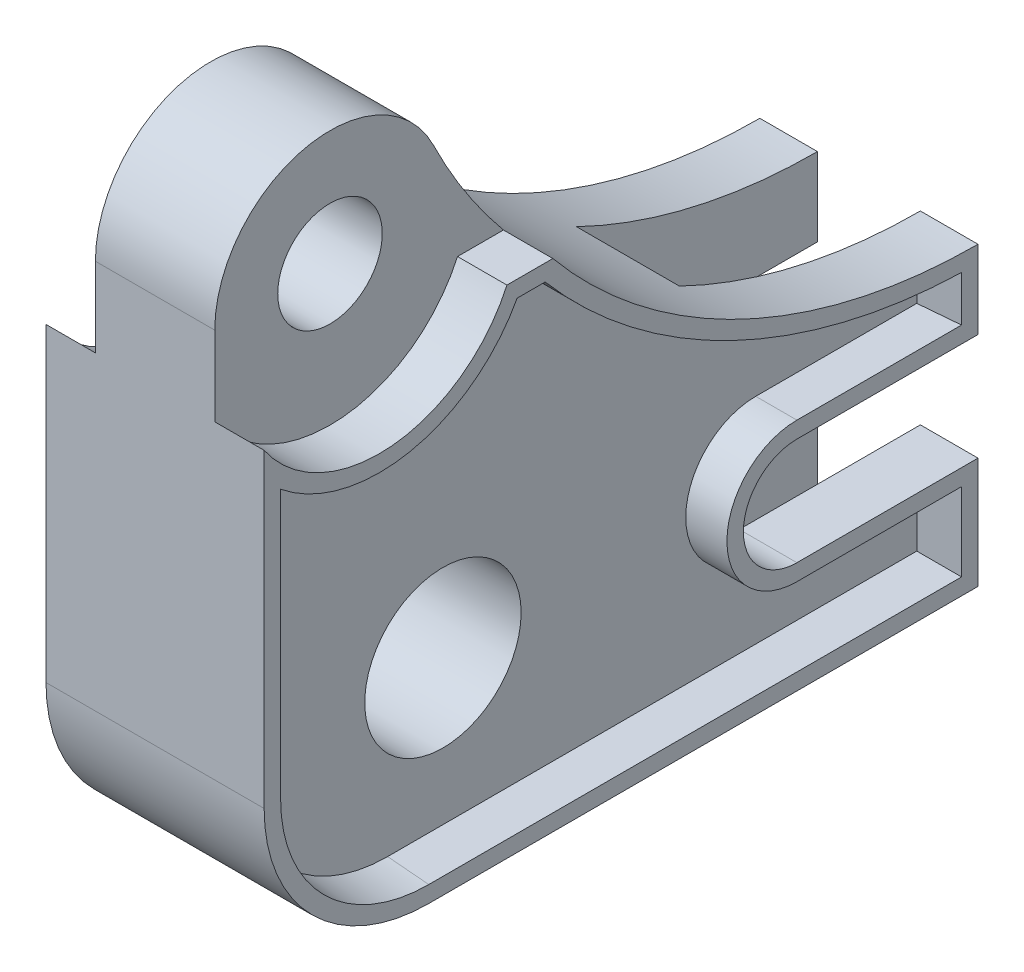
from build123d import *
from OCP.BRepFilletAPI import BRepFilletAPI_MakeChamfer

# Parameters (mm, degrees)
SKETCH2_R           = 6.35
BOSS_EXTRUDE1_DEPTH = 7.25
BOSS_EXTRUDE2_DEPTH = 13.25
SKETCH2_4_R         = 9.5
BOSS_EXTRUDE3_DEPTH = 8.25
CHAMFER1_SIZE       = 0.437443318
CHAMFER1_SIZE_2     = 5
SKETCH3_W           = 12.5
SKETCH3_H           = 38
CUT_EXTRUDE1_DEPTH  = 50


with BuildPart() as part:
    # Sketch2 → Boss-Extrude1 (new, symmetric)
    with BuildSketch(Plane(origin=(0, 0, 0), x_dir=(0, 0, -1), z_dir=(1, 0, 0))):
        with BuildLine():
            ThreePointArc((-17.444074423, 30.751237722), (-33.17807799, 38.221892264), (-44.012704688, 24.584428722))
            Line((-44.012704688, 24.584428722), (-44.012704688, 14.940777961))
            ThreePointArc((-44.012704688, 14.940777961), (-43.308060102, 13.990396231), (-42.539020478, 13.091325888))
            ThreePointArc((-42.539020478, 13.091325888), (-27.32091807, 7.798890756), (-14.520771303, 17.584428722))
            Line((-14.520771303, 17.584428722), (-8.941749337, 17.584428722))
            ThreePointArc((-8.941749337, 17.584428722), (-13.579253126, 23.918357524), (-17.444074423, 30.751237722))
        make_face()
        with Locations(Location((-30.012704688, 24.584428722, 0), (0, 0, 180))):
            Circle(SKETCH2_R, mode=Mode.SUBTRACT)
    extrude(amount=BOSS_EXTRUDE1_DEPTH, both=True)

    # Sketch2<3> → Boss-Extrude2 (add, symmetric)
    with BuildSketch(Plane(origin=(0, 0, 0), x_dir=(0, 0, -1), z_dir=(1, 0, 0))):
        with BuildLine():
            ThreePointArc((-42.539020478, 13.091325888), (-43.308060102, 13.990396231), (-44.012704688, 14.940777961))
            Line((-44.012704688, 14.940777961), (-44.012704688, -22.736176348))
            ThreePointArc((-44.012704688, -22.736176348), (-38.154840312, -36.878311972), (-24.012704688, -42.736176348))
            Line((-24.012704688, -42.736176348), (42.705798991, -42.736176348))
            Line((42.705798991, -42.736176348), (42.705798991, -29.236176348))
            Line((42.705798991, -29.236176348), (20.705798991, -29.236176348))
            ThreePointArc((20.705798991, -29.236176348), (14.205798991, -22.736176348), (20.705798991, -16.236176348))
            Line((20.705798991, -16.236176348), (42.705798991, -16.236176348))
            Line((42.705798991, -16.236176348), (42.705798991, -6.736176348))
            ThreePointArc((42.705798991, -6.736176348), (14.162143482, -0.351848663), (-8.941749337, 17.584428722))
            Line((-8.941749337, 17.584428722), (-14.520771303, 17.584428722))
            ThreePointArc((-14.520771303, 17.584428722), (-27.32091807, 7.798890756), (-42.539020478, 13.091325888))
        make_face()
        with BuildLine():
            ThreePointArc((-42.012704688, 9.853508859), (-26.296300857, 5.951438018), (-13.279504157, 15.584428722))
            Line((-13.279504157, 15.584428722), (-9.875106941, 15.584428722))
            ThreePointArc((-9.875106941, 15.584428722), (12.834584681, -1.93513579), (40.705798991, -8.70718475))
            Line((40.705798991, -8.70718475), (40.705798991, -14.236176348))
            Line((40.705798991, -14.236176348), (20.705798991, -14.236176348))
            ThreePointArc((20.705798991, -14.236176348), (12.205798991, -22.736176348), (20.705798991, -31.236176348))
            Line((20.705798991, -31.236176348), (40.705798991, -31.236176348))
            Line((40.705798991, -31.236176348), (40.705798991, -40.736176348))
            Line((40.705798991, -40.736176348), (-24.012704688, -40.736176348))
            ThreePointArc((-24.012704688, -40.736176348), (-36.74062675, -35.464098409), (-42.012704688, -22.736176348))
            Line((-42.012704688, -22.736176348), (-42.012704688, 9.853508859))
        make_face(mode=Mode.SUBTRACT)
    extrude(amount=BOSS_EXTRUDE2_DEPTH, both=True)

    # Sketch2<4> → Boss-Extrude3 (add, symmetric)
    with BuildSketch(Plane(origin=(0, 0, 0), x_dir=(0, 0, -1), z_dir=(1, 0, 0))):
        with BuildLine():
            Line((-42.012704688, 9.853508859), (-42.012704688, -22.736176348))
            ThreePointArc((-42.012704688, -22.736176348), (-36.74062675, -35.464098409), (-24.012704688, -40.736176348))
            Line((-24.012704688, -40.736176348), (40.705798991, -40.736176348))
            Line((40.705798991, -40.736176348), (40.705798991, -31.236176348))
            Line((40.705798991, -31.236176348), (20.705798991, -31.236176348))
            ThreePointArc((20.705798991, -31.236176348), (12.205798991, -22.736176348), (20.705798991, -14.236176348))
            Line((20.705798991, -14.236176348), (40.705798991, -14.236176348))
            Line((40.705798991, -14.236176348), (40.705798991, -8.70718475))
            ThreePointArc((40.705798991, -8.70718475), (12.834584681, -1.93513579), (-9.875106941, 15.584428722))
            Line((-9.875106941, 15.584428722), (-13.279504157, 15.584428722))
            ThreePointArc((-13.279504157, 15.584428722), (-26.296300857, 5.951438018), (-42.012704688, 9.853508859))
        make_face()
        with Locations((-17.294201009, -22.736176348)):
            Circle(SKETCH2_4_R, mode=Mode.SUBTRACT)
    extrude(amount=BOSS_EXTRUDE3_DEPTH, both=True)

    # Chamfer1
    chamfer1_edges_1 = [part.edges().sort_by_distance(p)[0] for p in [
        (-13.25, -40.736176348, -8.346547152),
    ]]
    chamfer1_side_1 = [part.faces().sort_by_distance(p)[0] for p in [
        (-13.25, -40.744925214, -8.346547152),
    ]]
    chamfer1_edges_2 = [part.edges().sort_by_distance(p)[0] for p in [
        (-13.25, -35.464098409, 36.74062675),
    ]]
    chamfer1_side_2 = [part.faces().sort_by_distance(p)[0] for p in [
        (-13.25, -35.470284792, 36.746813132),
    ]]
    chamfer1_edges_3 = [part.edges().sort_by_distance(p)[0] for p in [
        (-13.25, -6.441333744, 42.012704688),
    ]]
    chamfer1_side_3 = [part.faces().sort_by_distance(p)[0] for p in [
        (-13.25, -6.441333744, 42.021453555),
    ]]
    chamfer1_edges_4 = [part.edges().sort_by_distance(p)[0] for p in [
        (8.25, -40.736176348, -8.346547152),
    ]]
    chamfer1_side_4 = [part.faces().sort_by_distance(p)[0] for p in [
        (8.258748866, -40.736176348, -8.346547152),
    ]]
    chamfer1_edges_5 = [part.edges().sort_by_distance(p)[0] for p in [
        (8.25, -35.464098409, 36.74062675),
    ]]
    chamfer1_side_5 = [part.faces().sort_by_distance(p)[0] for p in [
        (8.258748866, -35.464098409, 36.74062675),
    ]]
    chamfer1_edges_6 = [part.edges().sort_by_distance(p)[0] for p in [
        (8.25, -6.441333744, 42.012704688),
    ]]
    chamfer1_side_6 = [part.faces().sort_by_distance(p)[0] for p in [
        (8.258748866, -6.441333744, 42.012704688),
    ]]
    chamfer1_edges_7 = [part.edges().sort_by_distance(p)[0] for p in [
        (-13.25, -35.986176348, -40.705798991),
    ]]
    chamfer1_side_7 = [part.faces().sort_by_distance(p)[0] for p in [
        (-13.25, -35.986176348, -40.714547858),
    ]]
    chamfer1_edges_8 = [part.edges().sort_by_distance(p)[0] for p in [
        (-13.25, -11.471680549, -40.705798991),
    ]]
    chamfer1_side_8 = [part.faces().sort_by_distance(p)[0] for p in [
        (-13.25, -11.471680549, -40.714547858),
    ]]
    chamfer1_edges_9 = [part.edges().sort_by_distance(p)[0] for p in [
        (8.25, -35.986176348, -40.705798991),
    ]]
    chamfer1_side_9 = [part.faces().sort_by_distance(p)[0] for p in [
        (8.258748866, -35.986176348, -40.705798991),
    ]]
    chamfer1_edges_10 = [part.edges().sort_by_distance(p)[0] for p in [
        (8.25, -11.471680549, -40.705798991),
    ]]
    chamfer1_side_10 = [part.faces().sort_by_distance(p)[0] for p in [
        (8.258748866, -11.471680549, -40.705798991),
    ]]
    chamfer1 = BRepFilletAPI_MakeChamfer(part.part.solid().wrapped)
    for e in chamfer1_edges_1:
        chamfer1.Add(CHAMFER1_SIZE - 0.0001, CHAMFER1_SIZE_2 - 0.0001, e.wrapped, chamfer1_side_1[0].wrapped)
    for e in chamfer1_edges_2:
        chamfer1.Add(CHAMFER1_SIZE - 0.0001, CHAMFER1_SIZE_2 - 0.0001, e.wrapped, chamfer1_side_2[0].wrapped)
    for e in chamfer1_edges_3:
        chamfer1.Add(CHAMFER1_SIZE - 0.0001, CHAMFER1_SIZE_2 - 0.0001, e.wrapped, chamfer1_side_3[0].wrapped)
    for e in chamfer1_edges_4:
        chamfer1.Add(CHAMFER1_SIZE_2 - 0.0001, CHAMFER1_SIZE - 0.0001, e.wrapped, chamfer1_side_4[0].wrapped)
    for e in chamfer1_edges_5:
        chamfer1.Add(CHAMFER1_SIZE_2 - 0.0001, CHAMFER1_SIZE - 0.0001, e.wrapped, chamfer1_side_5[0].wrapped)
    for e in chamfer1_edges_6:
        chamfer1.Add(CHAMFER1_SIZE_2 - 0.0001, CHAMFER1_SIZE - 0.0001, e.wrapped, chamfer1_side_6[0].wrapped)
    for e in chamfer1_edges_7:
        chamfer1.Add(CHAMFER1_SIZE - 0.0001, CHAMFER1_SIZE_2 - 0.0001, e.wrapped, chamfer1_side_7[0].wrapped)
    for e in chamfer1_edges_8:
        chamfer1.Add(CHAMFER1_SIZE - 0.0001, CHAMFER1_SIZE_2 - 0.0001, e.wrapped, chamfer1_side_8[0].wrapped)
    for e in chamfer1_edges_9:
        chamfer1.Add(CHAMFER1_SIZE_2 - 0.0001, CHAMFER1_SIZE - 0.0001, e.wrapped, chamfer1_side_9[0].wrapped)
    for e in chamfer1_edges_10:
        chamfer1.Add(CHAMFER1_SIZE_2 - 0.0001, CHAMFER1_SIZE - 0.0001, e.wrapped, chamfer1_side_10[0].wrapped)
    add(Compound.cast(chamfer1.Shape()), mode=Mode.REPLACE)  # a hair under: the kernel refuses the full size

    # Sketch3 → Cut-Extrude1 (cut)
    with BuildSketch(Plane(origin=(0, 0, 0), x_dir=(1, 0, 0), z_dir=(0, 1, 0))):
        with Locations((0, 23.705798991)):
            Rectangle(SKETCH3_W, SKETCH3_H)
    extrude(amount=-CUT_EXTRUDE1_DEPTH, mode=Mode.SUBTRACT)


solid = part.part
